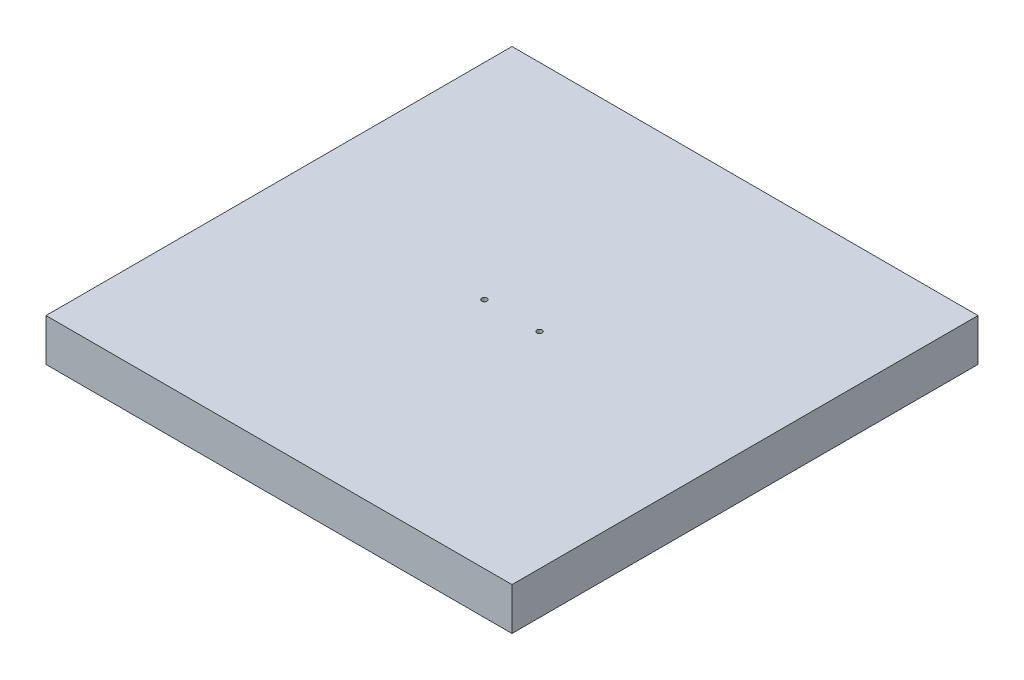
from build123d import *

# Parameters (mm, degrees)
SKETCH1_W           = 110
SKETCH1_H           = 110
BOSS_EXTRUDE1_DEPTH = 10
M1_6_TAPPED_HOLE1_D = 1.25


with BuildPart() as part:
    # Sketch1 → Boss-Extrude1 (new body)
    with BuildSketch(Plane(origin=(0, 0, 0), x_dir=(1, 0, 0), z_dir=(0, 1, 0))):
        Rectangle(SKETCH1_W, SKETCH1_H)
    extrude(amount=BOSS_EXTRUDE1_DEPTH)

    # M1.6 Tapped Hole1 (through all)
    with Locations(Plane(origin=(0, 10, 0), x_dir=(1, 0, 0), z_dir=(0, 1, 0))):
        with Locations((6.5, 0), (-6.5, 0)):
            Hole(M1_6_TAPPED_HOLE1_D / 2)


solid = part.part
